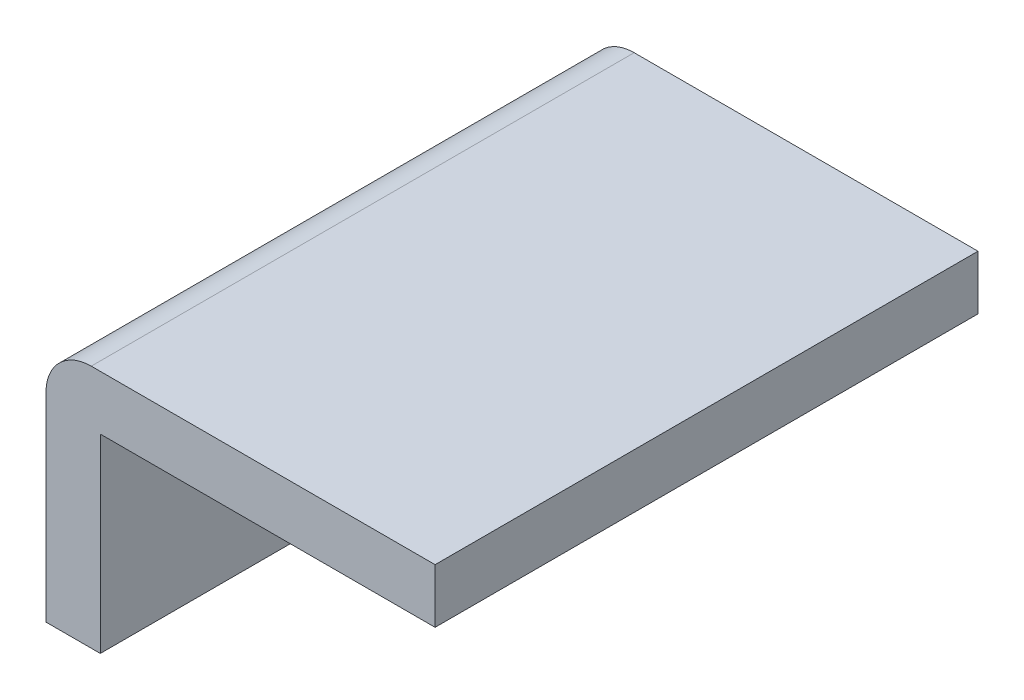
from build123d import *

# Parameters (mm, degrees)
BOSS_EXTRUDE1_DEPTH = 30


with BuildPart() as part:
    # Sketch1 → Boss-Extrude1 (new body)
    with BuildSketch(Plane.XY):
        with BuildLine():
            Line((-1.5, 0), (1.5, 0))
            Line((1.5, 0), (1.5, 10.5))
            Line((1.5, 10.5), (20, 10.5))
            Line((20, 10.5), (20, 13.5))
            Line((20, 13.5), (1, 13.5))
            ThreePointArc((1, 13.5), (-0.767766953, 12.767766953), (-1.5, 11))
            Line((-1.5, 11), (-1.5, 0))
        make_face()
    extrude(amount=BOSS_EXTRUDE1_DEPTH)


solid = part.part
